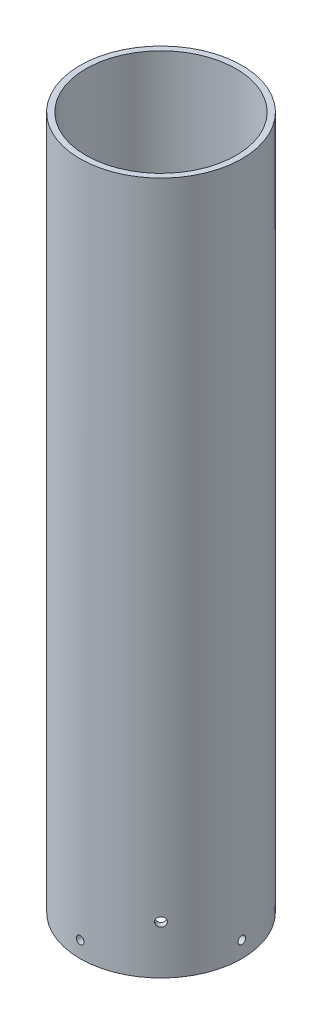
from build123d import *

# Parameters (mm, degrees)
SKETCH_1_R               = 25
SKETCH_1_R_2             = 23.2
EXTRUDE_1_DEPTH          = 214
SKETCH_5_R               = 1.2
CUT_EXTRUDE_5_DEPTH      = 217.90089903
PATTERN_CIRCULAR_1_COUNT = 4
SKETCH_6_R               = 1.4
CUT_EXTRUDE_6_DEPTH      = 217.900899153
PATTERN_CIRCULAR_2_COUNT = 4


with BuildPart() as part:
    # Эскиз1 → Бобышка-Вытянуть1 (new body)
    with BuildSketch(Plane(origin=(0, 0, 0), x_dir=(1, 0, 0), z_dir=(0, 1, 0))):
        Circle(SKETCH_1_R)
        Circle(SKETCH_1_R_2, mode=Mode.SUBTRACT)
    extrude(amount=EXTRUDE_1_DEPTH)

    # Эскиз5 → Вырез-Вытянуть5 (cut, through all)
    with BuildSketch(Plane.XY):
        with Locations((0, 5)):
            Circle(SKETCH_5_R)
    cut_extrude_5 = extrude(amount=-CUT_EXTRUDE_5_DEPTH, mode=Mode.SUBTRACT)

    # Круговой массив1: Вырез-Вытянуть5 ×4 about axis
    pattern_circular_1_axis = Axis((0, 214, 0), (0, -1, 0))
    for i in range(1, PATTERN_CIRCULAR_1_COUNT):
        add(cut_extrude_5.rotate(pattern_circular_1_axis, i * 360 / PATTERN_CIRCULAR_1_COUNT), mode=Mode.SUBTRACT)

    # Эскиз6 → Вырез-Вытянуть6 (cut, through all)
    with BuildSketch(Plane(origin=(0, 0, 0), x_dir=(0, -1, 0), z_dir=(-0.7071067811865488, 0, 0.7071067811865464))):
        with Locations((-15, 0)):
            Circle(SKETCH_6_R)
    cut_extrude_6 = extrude(amount=-CUT_EXTRUDE_6_DEPTH, mode=Mode.SUBTRACT)

    # Круговой массив2: Вырез-Вытянуть6 ×4 about axis
    pattern_circular_2_axis = Axis((0, 214, 0), (0, -1, 0))
    for i in range(1, PATTERN_CIRCULAR_2_COUNT):
        add(cut_extrude_6.rotate(pattern_circular_2_axis, i * 360 / PATTERN_CIRCULAR_2_COUNT), mode=Mode.SUBTRACT)


solid = part.part
